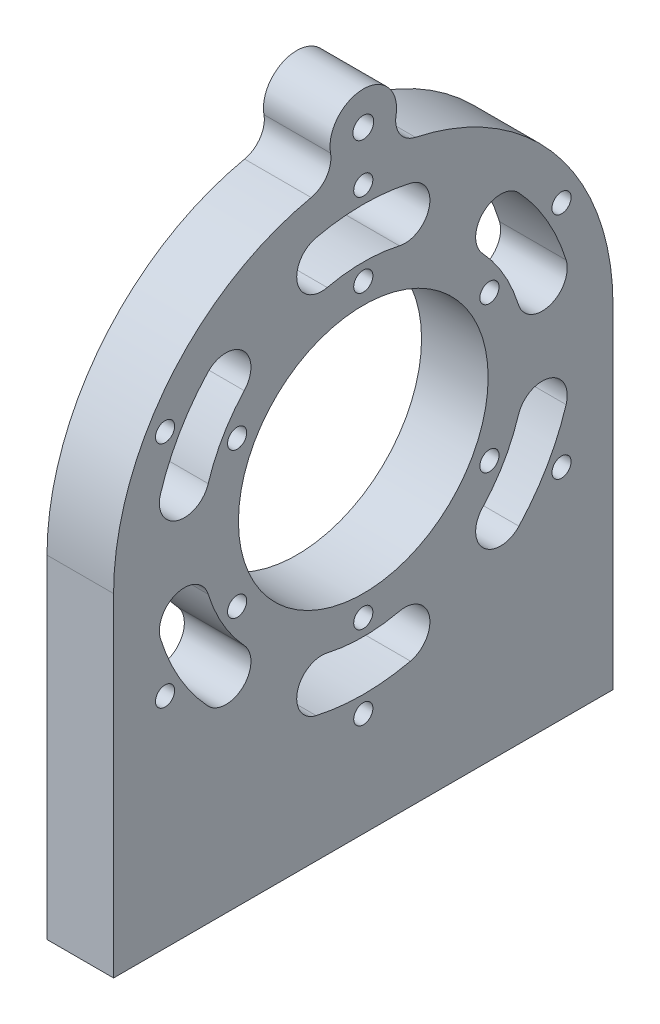
from build123d import *

# Parameters (mm, degrees)
SKETCH_1_R             = 1.15
SKETCH_1_R_2           = 15
SKETCH_1_R_3           = 1.25
EXTRUDE_1_DEPTH        = 4
HOLE_WIZARD_M3_1_D     = 2.5
HOLE_WIZARD_M3_1_DEPTH = 7.5
HOLE_WIZARD_M3_1_TIP   = 0.751075774


with BuildPart() as part:
    # 草图1 → 凸台-拉伸1 (new, symmetric)
    with BuildSketch(Plane(origin=(0, 0, 0), x_dir=(0, 0, -1), z_dir=(1, 0, 0))):
        with BuildLine():
            Line((30, -40), (30, 0))
            ThreePointArc((30, 0), (23.323275812, 18.868619595), (6.265012972, 29.3385346))
            ThreePointArc((6.265012972, 29.3385346), (4.402143602, 30.598161767), (3.938008154, 32.798507463))
            ThreePointArc((3.938008154, 32.798507463), (0, 37.5), (-3.938008154, 32.798507463))
            ThreePointArc((-3.938008154, 32.798507463), (-4.402143602, 30.598161767), (-6.265012972, 29.3385346))
            ThreePointArc((-6.265012972, 29.3385346), (-23.323275812, 18.868619595), (-30, 0))
            Line((-30, 0), (-30, -40))
            Line((-30, -40), (30, -40))
        make_face()
        with BuildLine():
            ThreePointArc((4.333333333, 19.012422839), (0, 19.5), (-4.333333333, 19.012422839))
            ThreePointArc((-4.333333333, 19.012422839), (-7.924988129, 21.270744302), (-5.666666667, 24.862399098))
            ThreePointArc((-5.666666667, 24.862399098), (0, 25.5), (5.666666667, 24.862399098))
            ThreePointArc((5.666666667, 24.862399098), (7.924988129, 21.270744302), (4.333333333, 19.012422839))
        make_face(mode=Mode.SUBTRACT)
        with BuildLine():
            ThreePointArc((-5.666666667, -24.862399098), (-7.924988129, -21.270744302), (-4.333333333, -19.012422839))
            ThreePointArc((-4.333333333, -19.012422839), (0, -19.5), (4.333333333, -19.012422839))
            ThreePointArc((4.333333333, -19.012422839), (7.924988129, -21.270744302), (5.666666667, -24.862399098))
            ThreePointArc((5.666666667, -24.862399098), (0, -25.5), (-5.666666667, -24.862399098))
        make_face(mode=Mode.SUBTRACT)
        with Locations((-23.815698604, -13.75)):
            Circle(SKETCH_1_R, mode=Mode.SUBTRACT)
        with BuildLine():
            ThreePointArc((-24.364802551, -7.523722261), (-22.383498987, -3.772131106), (-18.631907833, -5.75343467))
            ThreePointArc((-18.631907833, -5.75343467), (-16.887495374, -9.75), (-14.2985745, -13.258988169))
            ThreePointArc((-14.2985745, -13.258988169), (-14.458510858, -17.498613195), (-18.698135884, -17.338676837))
            ThreePointArc((-18.698135884, -17.338676837), (-22.083647797, -12.75), (-24.364802551, -7.523722261))
        make_face(mode=Mode.SUBTRACT)
        with Locations((-15.155444566, -8.75)):
            Circle(SKETCH_1_R, mode=Mode.SUBTRACT)
        with Locations((0, -27.5)):
            Circle(SKETCH_1_R, mode=Mode.SUBTRACT)
        with Locations((0, -17.5)):
            Circle(SKETCH_1_R, mode=Mode.SUBTRACT)
        with BuildLine():
            ThreePointArc((18.631907833, -5.75343467), (22.383498987, -3.772131106), (24.364802551, -7.523722261))
            ThreePointArc((24.364802551, -7.523722261), (22.083647797, -12.75), (18.698135884, -17.338676837))
            ThreePointArc((18.698135884, -17.338676837), (14.458510858, -17.498613195), (14.2985745, -13.258988169))
            ThreePointArc((14.2985745, -13.258988169), (16.887495374, -9.75), (18.631907833, -5.75343467))
        make_face(mode=Mode.SUBTRACT)
        with Locations((23.815698604, -13.75)):
            Circle(SKETCH_1_R, mode=Mode.SUBTRACT)
        with Locations((15.155444566, -8.75)):
            Circle(SKETCH_1_R, mode=Mode.SUBTRACT)
        with Locations((-23.815698604, 13.75)):
            Circle(SKETCH_1_R, mode=Mode.SUBTRACT)
        with BuildLine():
            ThreePointArc((-18.698135884, 17.338676837), (-14.458510858, 17.498613195), (-14.2985745, 13.258988169))
            ThreePointArc((-14.2985745, 13.258988169), (-16.887495374, 9.75), (-18.631907833, 5.75343467))
            ThreePointArc((-18.631907833, 5.75343467), (-22.383498987, 3.772131106), (-24.364802551, 7.523722261))
            ThreePointArc((-24.364802551, 7.523722261), (-22.083647797, 12.75), (-18.698135884, 17.338676837))
        make_face(mode=Mode.SUBTRACT)
        with Locations((-15.155444566, 8.75)):
            Circle(SKETCH_1_R, mode=Mode.SUBTRACT)
        Circle(SKETCH_1_R_2, mode=Mode.SUBTRACT)
        with Locations((0, 17.5)):
            Circle(SKETCH_1_R, mode=Mode.SUBTRACT)
        with Locations((0, 27.5)):
            Circle(SKETCH_1_R, mode=Mode.SUBTRACT)
        with Locations((0, 33.5)):
            Circle(SKETCH_1_R_3, mode=Mode.SUBTRACT)
        with Locations((15.155444566, 8.75)):
            Circle(SKETCH_1_R, mode=Mode.SUBTRACT)
        with BuildLine():
            ThreePointArc((24.364802551, 7.523722261), (22.383498987, 3.772131106), (18.631907833, 5.75343467))
            ThreePointArc((18.631907833, 5.75343467), (16.887495374, 9.75), (14.2985745, 13.258988169))
            ThreePointArc((14.2985745, 13.258988169), (14.458510858, 17.498613195), (18.698135884, 17.338676837))
            ThreePointArc((18.698135884, 17.338676837), (22.083647797, 12.75), (24.364802551, 7.523722261))
        make_face(mode=Mode.SUBTRACT)
        with Locations((23.815698604, 13.75)):
            Circle(SKETCH_1_R, mode=Mode.SUBTRACT)
    extrude(amount=EXTRUDE_1_DEPTH, both=True)

    # M3 螺纹孔1
    with Locations(Plane(origin=(0, -40, 22.5), x_dir=(0, 0, -1), z_dir=(0, -1, 0))):
        with Locations((0, 0), (22.5, 0), (45, 0)):
            Hole(HOLE_WIZARD_M3_1_D / 2, depth=HOLE_WIZARD_M3_1_DEPTH)
            with Locations((0, 0, -(HOLE_WIZARD_M3_1_DEPTH + HOLE_WIZARD_M3_1_TIP / 2))):  # 118° drill point
                Cone(0, HOLE_WIZARD_M3_1_D / 2, HOLE_WIZARD_M3_1_TIP, mode=Mode.SUBTRACT)


solid = part.part
